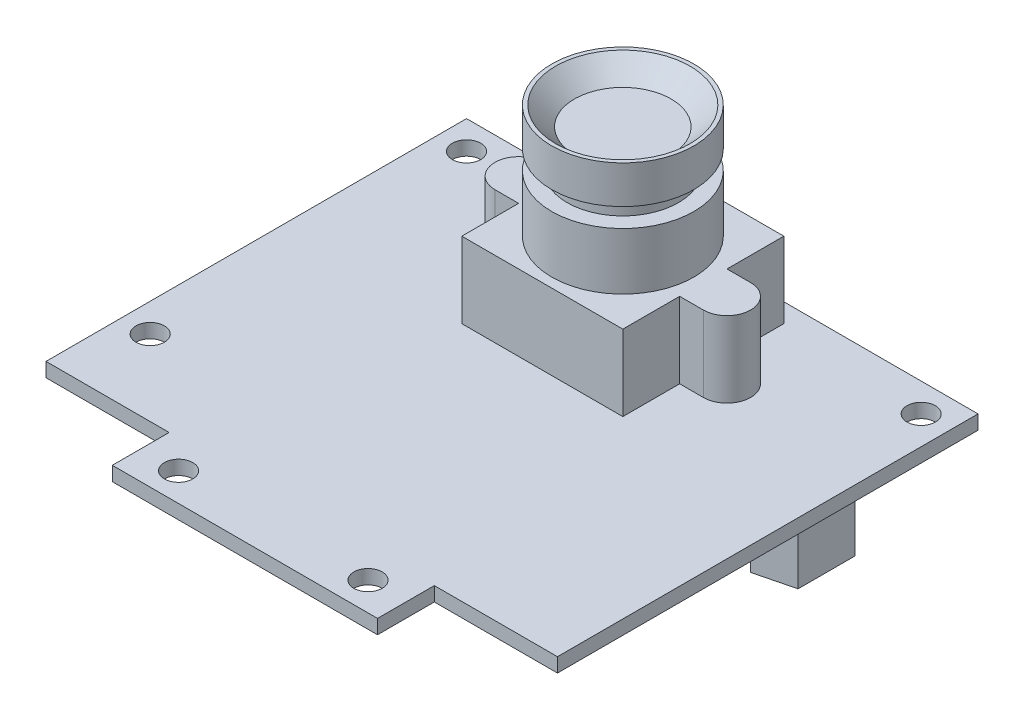
from build123d import *

# Parameters (mm, degrees)
SKETCH1_W           = 54
SKETCH1_H           = 44.4
SKETCH1_W_2         = 28
SKETCH1_H_2         = 6
BOSS_EXTRUDE1_DEPTH = 1.5
SKETCH2_R           = 1.5
SKETCH2_R_2         = 1
CUT_EXTRUDE1_DEPTH  = 1.5
BOSS_EXTRUDE2_DEPTH = 8
SKETCH4_R           = 7.5
BOSS_EXTRUDE3_DEPTH = 6
SKETCH5_R           = 5.877121991
BOSS_EXTRUDE4_DEPTH = 2
SKETCH6_R           = 7.5
BOSS_EXTRUDE5_DEPTH = 4
SKETCH7_R           = 5.097427656
CUT_EXTRUDE3_DEPTH  = 2
CHAMFER1_SIZE       = 2
BOSS_EXTRUDE6_DEPTH = 10
SKETCH9_W           = 9
SKETCH9_H           = 21
BOSS_EXTRUDE7_DEPTH = 10


with BuildPart() as part:
    # Sketch1 → Boss-Extrude1 (new body)
    with BuildSketch(Plane(origin=(0, 0, 0), x_dir=(1, 0, 0), z_dir=(0, 1, 0))):
        Rectangle(SKETCH1_W, SKETCH1_H)
        with Locations((0, -25.2)):
            Rectangle(SKETCH1_W_2, SKETCH1_H_2)
    extrude(amount=BOSS_EXTRUDE1_DEPTH)

    # Sketch2 → Cut-Extrude1 (cut)
    with BuildSketch(Plane(origin=(0, 1.5, 0), x_dir=(1, 0, 0), z_dir=(0, 1, 0))):
        with Locations(Location((-24, 19.2, 0), (0, 0, 270))):
            Circle(SKETCH2_R)
        with Locations(Location((24, 19.2, 0), (0, 0, 270))):
            Circle(SKETCH2_R)
        with Locations(Location((-24, -14.2, 0), (0, 0, 270))):
            Circle(SKETCH2_R)
        with Locations(Location((-10, -25.2, 0), (0, 0, 270))):
            Circle(SKETCH2_R)
        with Locations(Location((10, -25.2, 0), (0, 0, 270))):
            Circle(SKETCH2_R)
        with Locations(Location((0, 11.7, 0), (0, 0, 270))):
            Circle(SKETCH2_R_2)
    extrude(amount=-CUT_EXTRUDE1_DEPTH, mode=Mode.SUBTRACT)

    # Sketch3 → Boss-Extrude2 (add)
    with BuildSketch(Plane(origin=(0, 1.5, 0), x_dir=(1, 0, 0), z_dir=(0, 1, 0))):
        with BuildLine():
            Line((-8.5, 20.2), (8.5, 20.2))
            Line((8.5, 20.2), (8.5, 14.2))
            Line((8.5, 14.2), (11, 14.2))
            ThreePointArc((11, 14.2), (13.5, 11.7), (11, 9.2))
            Line((11, 9.2), (8.5, 9.2))
            Line((8.5, 9.2), (8.5, 3.2))
            Line((8.5, 3.2), (-8.5, 3.2))
            Line((-8.5, 3.2), (-8.5, 9.2))
            Line((-8.5, 9.2), (-11, 9.2))
            ThreePointArc((-11, 9.2), (-13.5, 11.7), (-11, 14.2))
            Line((-11, 14.2), (-8.5, 14.2))
            Line((-8.5, 14.2), (-8.5, 20.2))
        make_face()
    extrude(amount=BOSS_EXTRUDE2_DEPTH)

    # Sketch4 → Boss-Extrude3 (add)
    with BuildSketch(Plane(origin=(0, 9.5, 0), x_dir=(1, 0, 0), z_dir=(0, 1, 0))):
        with Locations(Location((0, 11.7, 0), (0, 0, 270))):
            Circle(SKETCH4_R)
    extrude(amount=BOSS_EXTRUDE3_DEPTH)

    # Sketch5 → Boss-Extrude4 (add)
    with BuildSketch(Plane(origin=(0, 15.5, 0), x_dir=(1, 0, 0), z_dir=(0, 1, 0))):
        with Locations(Location((0, 11.7, 0), (0, 0, 270))):
            Circle(SKETCH5_R)
    extrude(amount=BOSS_EXTRUDE4_DEPTH)

    # Sketch6 → Boss-Extrude5 (add)
    with BuildSketch(Plane(origin=(0, 17.5, 0), x_dir=(1, 0, 0), z_dir=(0, 1, 0))):
        with Locations(Location((0, 11.7, 0), (0, 0, 270))):
            Circle(SKETCH6_R)
    extrude(amount=BOSS_EXTRUDE5_DEPTH)

    # Sketch7 → Cut-Extrude3 (cut)
    with BuildSketch(Plane(origin=(0, 21.5, 0), x_dir=(1, 0, 0), z_dir=(0, 1, 0))):
        with Locations(Location((0, 11.7, 0), (0, 0, 270))):
            Circle(SKETCH7_R)
    extrude(amount=-CUT_EXTRUDE3_DEPTH, mode=Mode.SUBTRACT)

    # Chamfer1
    chamfer1_edges = [part.edges().sort_by_distance(p)[0] for p in [
        (0, 21.5, -16.797427656),
    ]]
    chamfer(chamfer1_edges, length=CHAMFER1_SIZE - 0.0001)  # a hair under: the kernel refuses the full size

    # Sketch8 → Boss-Extrude6 (add)
    with BuildSketch(Plane.XZ):
        Polygon((18, -7.2), (18, -15.2), (22, -14.2), (22, -8.2), align=None)
    extrude(amount=BOSS_EXTRUDE6_DEPTH)

    # Sketch9 → Boss-Extrude7 (add)
    with BuildSketch(Plane.XZ):
        with Locations((-18, -8.7)):
            Rectangle(SKETCH9_W, SKETCH9_H)
    extrude(amount=BOSS_EXTRUDE7_DEPTH)


solid = part.part
